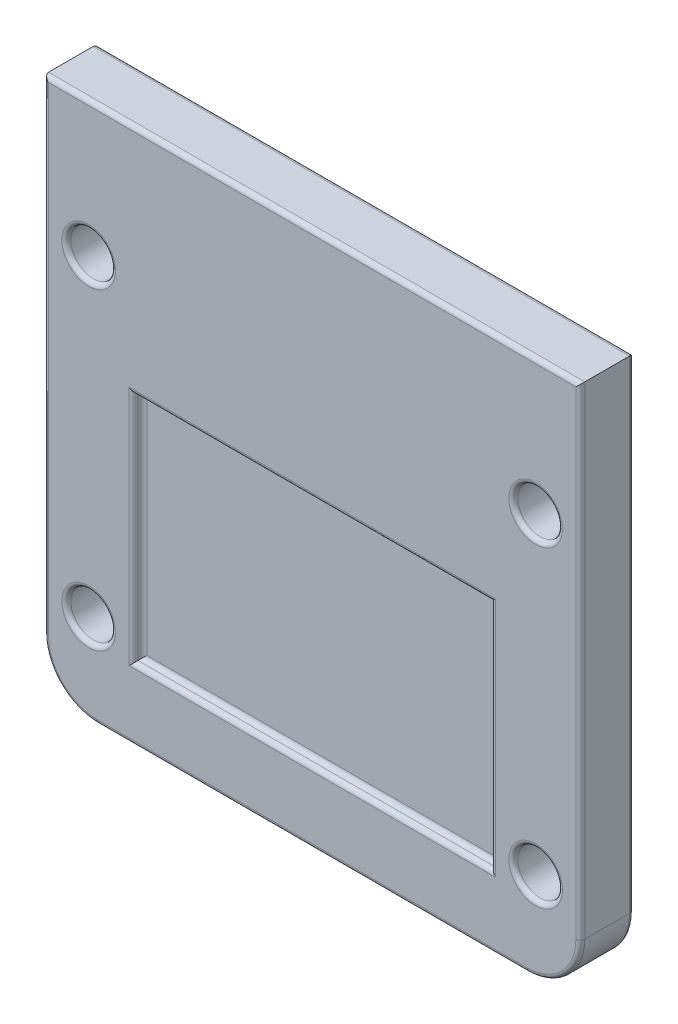
from build123d import *

# Parameters (mm, degrees)
SKETCH1_W             = 60
SKETCH1_H             = 60
BOSS_EXTRUDE1_DEPTH   = 6
F_5_0MM_DOWEL_HOLE1_D = 5
FILLET1_R             = 6
SKETCH2_W             = 40
SKETCH2_H             = 26
CUT_EXTRUDE1_DEPTH    = 1
FILLET2_R             = 0.5


with BuildPart() as part:
    # Sketch1 → Boss-Extrude1 (new body)
    with BuildSketch(Plane.XY):
        with Locations((30, 30)):
            Rectangle(SKETCH1_W, SKETCH1_H)
    extrude(amount=BOSS_EXTRUDE1_DEPTH)

    # Ø5.0mm Dowel Hole1 (through all)
    with Locations(Plane.XY.offset(6)):
        with Locations((5, 10), (55, 10), (55, 45), (5, 45)):
            Hole(F_5_0MM_DOWEL_HOLE1_D / 2)

    # Fillet1
    fillet1_edges = [part.edges().sort_by_distance(p)[0] for p in [
        (60, 0, 3),
        (0, 0, 3),
    ]]
    fillet(fillet1_edges, radius=FILLET1_R)

    # Sketch2 → Cut-Extrude1 (cut)
    with BuildSketch(Plane.XY.offset(6)):
        with Locations((30, 21)):
            Rectangle(SKETCH2_W, SKETCH2_H)
    extrude(amount=-CUT_EXTRUDE1_DEPTH, mode=Mode.SUBTRACT)

    # Fillet2
    fillet2_edges = [part.edges().sort_by_distance(p)[0] for p in [
        (30, 60, 0),
        (0, 33, 0),
        (1.757359313, 1.757359313, 0),
        (30, 0, 0),
        (58.242640687, 1.757359313, 0),
        (60, 33, 0),
        (7.5, 45, 0),
        (57.5, 45, 0),
        (57.5, 10, 0),
        (7.5, 10, 0),
        (1.757359313, 1.757359313, 6),
        (0, 33, 6),
        (30, 60, 6),
        (60, 33, 6),
        (58.242640687, 1.757359313, 6),
        (30, 0, 6),
        (7.5, 45, 6),
        (57.5, 45, 6),
        (57.5, 10, 6),
        (7.5, 10, 6),
        (50, 21, 6),
        (30, 34, 6),
        (10, 21, 6),
        (30, 8, 6),
        (30, 34, 5),
        (50, 21, 5),
        (30, 8, 5),
        (10, 21, 5),
    ]]
    fillet(fillet2_edges, radius=FILLET2_R - 0.0001)  # a hair under: the kernel refuses the full size


solid = part.part
